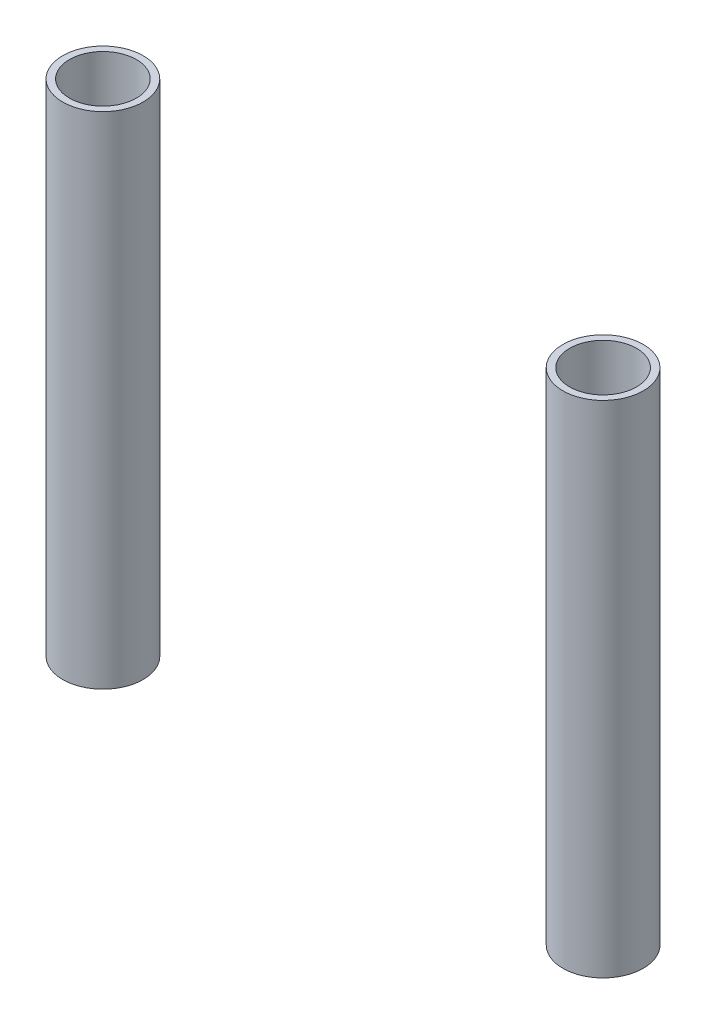
from build123d import *

# Parameters (mm, degrees)
SKETCH1_R             = 8.038978159
SKETCH1_R_2           = 6.692778159
BOSS_EXTRUDE1_DEPTH   = 100
BOSS_EXTRUDE1_2_DEPTH = 100


with BuildPart() as part:
    # Sketch1 → Boss-Extrude1 (new body)
    with BuildSketch(Plane(origin=(0, 0, 0), x_dir=(1, 0, 0), z_dir=(0, 1, 0))):
        with Locations((-50, 0)):
            Circle(SKETCH1_R)
        with Locations((-50, 0)):
            Circle(SKETCH1_R_2, mode=Mode.SUBTRACT)
    extrude(amount=BOSS_EXTRUDE1_DEPTH)


with BuildPart() as body_2:
    # Sketch1 → Boss-Extrude1 2 (new body)
    with BuildSketch(Plane(origin=(0, 0, 0), x_dir=(1, 0, 0), z_dir=(0, 1, 0))):
        with Locations((50, 0)):
            Circle(SKETCH1_R)
        with Locations((50, 0)):
            Circle(SKETCH1_R_2, mode=Mode.SUBTRACT)
    extrude(amount=BOSS_EXTRUDE1_2_DEPTH)


solid = Compound([part.part, body_2.part])
